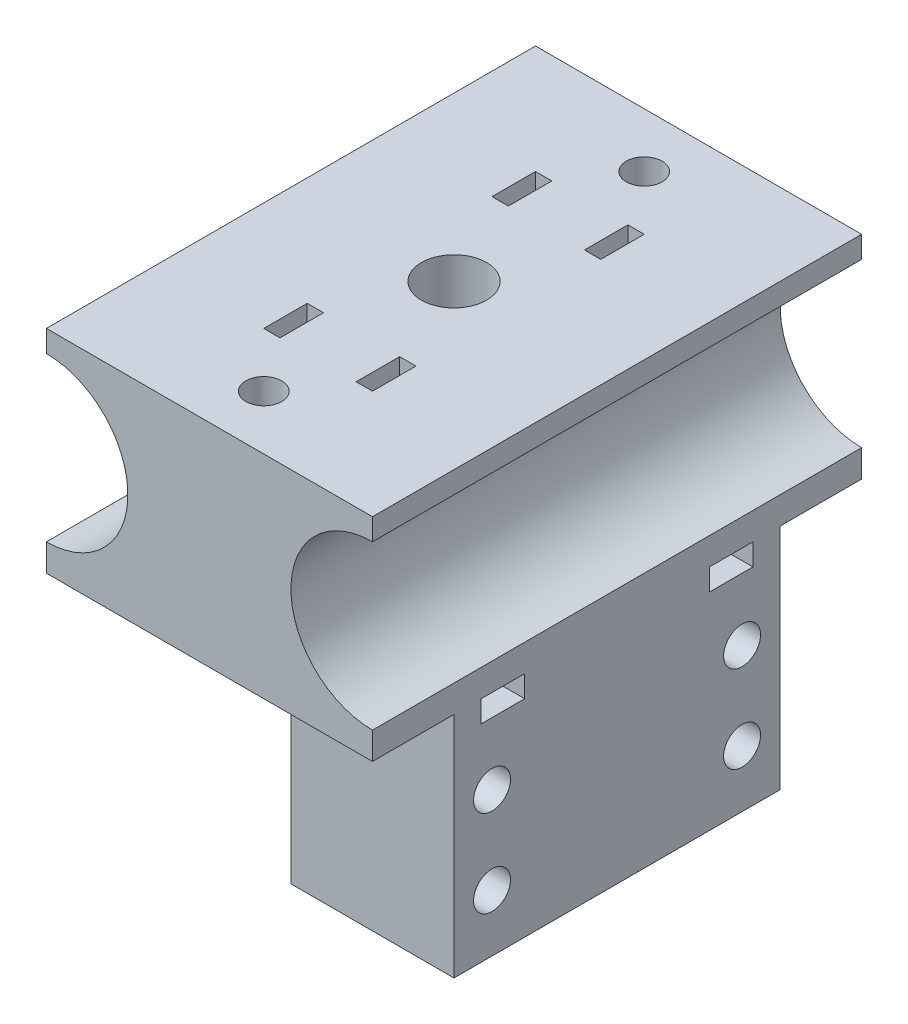
from build123d import *

# Parameters (mm, degrees)
BOSS_EXTRUDE1_DEPTH   = 22.5
M4X0_7_TAPPED_HOLE2_D = 3.3
REVOLVE1_ANGLE        = 180
BOSS_EXTRUDE4_REACH   = 50.698
M3_CLEARANCE_HOLE1_D  = 3.4
SKETCH2_R             = 3
CUT_EXTRUDE1_DEPTH    = 50
CUT_EXTRUDE3_START    = -10
CUT_EXTRUDE3_DEPTH    = 4


with BuildPart() as part:
    # Sketch1 → Boss-Extrude1 (new, symmetric)
    with BuildSketch(Plane.XY):
        with BuildLine():
            Line((-15, 7.5), (-15, 9.5))
            Line((-15, 9.5), (15, 9.5))
            Line((15, 9.5), (15, 7.5))
            ThreePointArc((15, 7.5), (7.5, 0), (15, -7.5))
            Line((15, -7.5), (15, -10))
            Line((15, -10), (-15, -10))
            Line((-15, -10), (-15, -7.5))
            ThreePointArc((-15, -7.5), (-7.5, 0), (-15, 7.5))
        make_face()
    extrude(amount=BOSS_EXTRUDE1_DEPTH, both=True)

    # M4x0.7 Tapped Hole2 (through all)
    with Locations(Plane(origin=(0, -10, 0), x_dir=(-1, 0, 0), z_dir=(0, -1, 0))):
        with Locations((0, -17.5), (0, 17.5)):
            Hole(M4X0_7_TAPPED_HOLE2_D / 2)

    # Sketch12 → Revolve1 (revolve, symmetric)
    with BuildSketch(Plane.XY) as revolve1_sk:
        Polygon((8, -31), (8, -24.5), (6, -24.5), (6, -19), (8, -19), (8, -10), (15, -10), (15, -31), align=None)
    revolve(axis=Axis((0, 0, 0), (0, -1, 0)), revolution_arc=REVOLVE1_ANGLE / 2)
    revolve(revolve1_sk.sketch, axis=Axis((0, 0, 0), (0, 1, 0)), revolution_arc=REVOLVE1_ANGLE / 2)

    # Sketch15 → Boss-Extrude4 (add, up to next)
    with BuildSketch(Plane.XZ.offset(31), mode=Mode.PRIVATE) as boss_extrude4_sk1:
        with BuildLine():
            Line((15, 15), (0, 15))
            ThreePointArc((0, 15), (10.606601729, 10.606601707), (15, -3.1e-08))
            Line((15, -3.1e-08), (15, 15))
        make_face()
    boss_extrude4_tool1 = extrude(boss_extrude4_sk1.sketch, amount=-BOSS_EXTRUDE4_REACH, mode=Mode.PRIVATE) - part.part
    # Sketch15 → Boss-Extrude4 (add, up to next)
    with BuildSketch(Plane.XZ.offset(31), mode=Mode.PRIVATE) as boss_extrude4_sk2:
        with BuildLine():
            Line((15, -15), (15, -3.1e-08))
            ThreePointArc((15, -3.1e-08), (10.606601707, -10.606601729), (0, -15))
            Line((0, -15), (15, -15))
        make_face()
    boss_extrude4_tool2 = extrude(boss_extrude4_sk2.sketch, amount=-BOSS_EXTRUDE4_REACH, mode=Mode.PRIVATE) - part.part
    add(boss_extrude4_tool1.solids().sort_by_distance((11.649481, -31, 11.649481))[0])
    add(boss_extrude4_tool2.solids().sort_by_distance((11.649481, -31, -11.649481))[0])

    # M3 Clearance Hole1 (through all)
    with Locations(Plane.ZY):
        with Locations((-11.5, -17.75), (-11.5, -25.75), (11.5, -25.75), (11.5, -17.75)):
            Hole(M3_CLEARANCE_HOLE1_D / 2)

    # Sketch2 → Cut-Extrude1 (cut)
    with BuildSketch(Plane(origin=(0, 9.5, 0), x_dir=(1, 0, 0), z_dir=(0, 1, 0))):
        Circle(SKETCH2_R)
    extrude(amount=-CUT_EXTRUDE1_DEPTH, mode=Mode.SUBTRACT)

    # Sketch11 → Cut-Extrude3 (cut)
    with BuildSketch(Plane(origin=(0, 0, -22.5), x_dir=(-1, 0, 0), z_dir=(0, 0, -1)).offset(CUT_EXTRUDE3_START)):
        with BuildLine():
            Line((-5, 9.5), (-5, 0))
            ThreePointArc((-5, 0), (-7.928932188, -7.071067812), (-15, -10))
            Line((-15, -10), (-15, -12))
            Line((-15, -12), (-3.5, -12))
            Line((-3.5, -12), (-3.5, -10))
            Line((-3.5, -10), (-3.5, 9.5))
            Line((-3.5, 9.5), (-5, 9.5))
        make_face()
        with BuildLine():
            Line((3.5, 9.5), (5, 9.5))
            Line((5, 9.5), (5, 0))
            ThreePointArc((5, 0), (7.928932188, -7.071067812), (15, -10))
            Line((15, -10), (15, -12))
            Line((15, -12), (3.5, -12))
            Line((3.5, -12), (3.5, -10))
            Line((3.5, -10), (3.5, 9.5))
        make_face()
    cut_extrude3 = extrude(amount=-CUT_EXTRUDE3_DEPTH, mode=Mode.SUBTRACT)

    # Mirror1: Cut-Extrude3 across plane
    add(cut_extrude3.mirror(Plane.XY), mode=Mode.SUBTRACT)


solid = part.part
